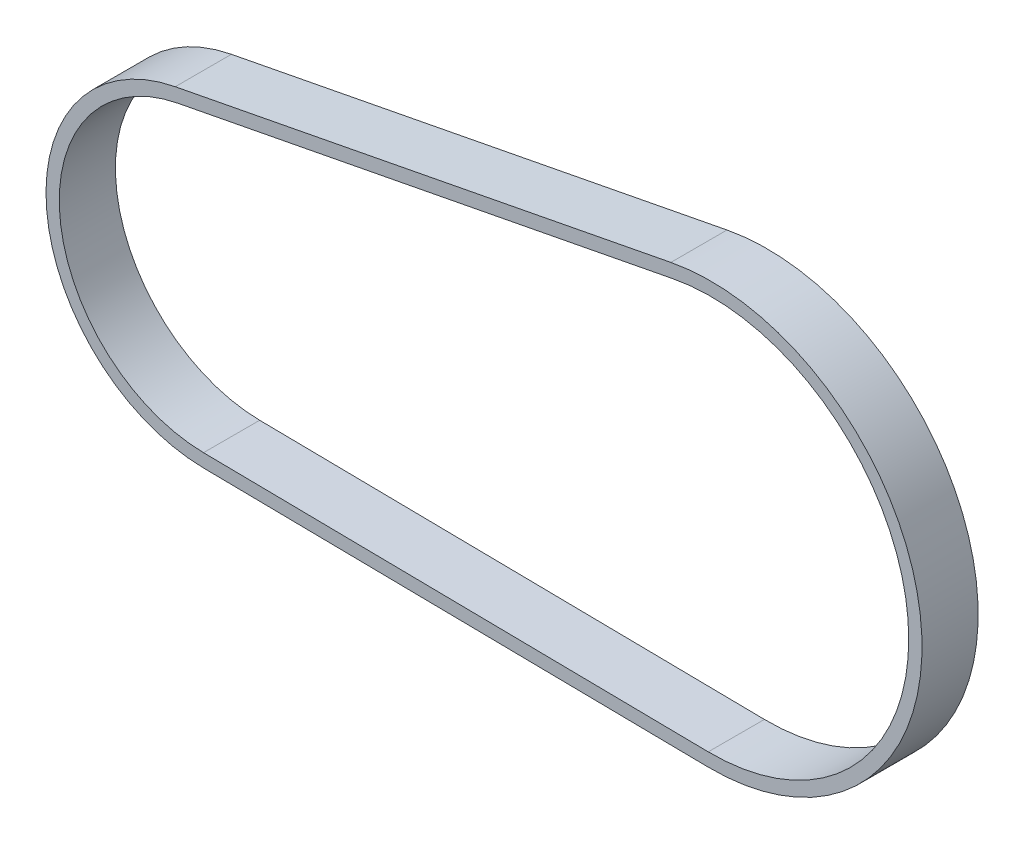
from build123d import *

# Parameters (mm, degrees)
EXTRUDE_THIN1_DEPTH = 3.175


with BuildPart() as part:
    # Sketch2 → Extrude-Thin1 (new, symmetric)
    with BuildSketch(Plane.XY):
        with BuildLine():
            Line((-3.417452016, 17.70723518), (52.625486063, 28.523381788))
            ThreePointArc((52.625486063, 28.523381788), (80.932230369, 7.193976033), (56.831464451, -18.793875075))
            Line((56.831464451, -18.793875075), (-0.240596, -18.032395004))
            ThreePointArc((-0.240596, -18.032395004), (-17.963174002, -1.596726578), (-3.417452016, 17.70723518))
        make_face()
        with BuildLine():
            Line((-3.133201266, 16.234414243), (52.909736813, 27.050560851))
            ThreePointArc((52.909736813, 27.050560851), (79.438121408, 7.061166347), (56.851476318, -17.294008573))
            Line((56.851476318, -17.294008573), (-0.220584133, -16.532528501))
            ThreePointArc((-0.220584133, -16.532528501), (-16.469065041, -1.463916893), (-3.133201266, 16.234414243))
        make_face(mode=Mode.SUBTRACT)
    extrude(amount=EXTRUDE_THIN1_DEPTH, both=True)


solid = part.part
